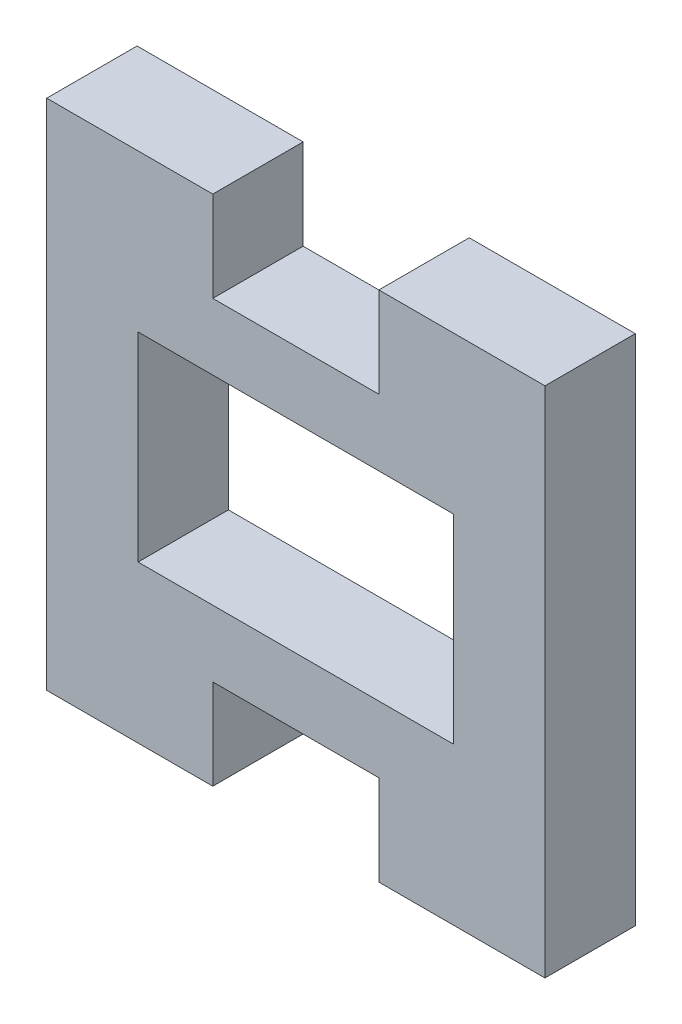
from build123d import *

# Parameters (mm, degrees)
SKETCH1_W           = 30
SKETCH1_H           = 30.88
BOSS_EXTRUDE1_DEPTH = 5.44
SKETCH2_W           = 19
SKETCH2_H           = 12
CUT_EXTRUDE1_DEPTH  = 44.395483636
CAVITY1_OUTLINE_W   = 10
CAVITY1_OUTLINE_H   = 5.44
CAVITY1_DEPTH       = 5.44
CAVITY1_START       = 25.44
CAVITY1_2_OUTLINE_W = 10
CAVITY1_2_OUTLINE_H = 5.44
CAVITY1_2_DEPTH     = 5.44


# Read off the part's stored shape, not the designer's step: Cavity1
with BuildPart() as part:
    # Sketch1 → Boss-Extrude1 (new body)
    with BuildSketch(Plane.XY):
        with Locations((15, 15.44)):
            Rectangle(SKETCH1_W, SKETCH1_H)
    extrude(amount=BOSS_EXTRUDE1_DEPTH)

    # Sketch2 → Cut-Extrude1 (cut, through all)
    with BuildSketch(Plane(origin=(0, 0, 0), x_dir=(-1, 0, 0), z_dir=(0, 0, -1))):
        with Locations((-15, 15.44)):
            Rectangle(SKETCH2_W, SKETCH2_H)
    extrude(amount=-CUT_EXTRUDE1_DEPTH, mode=Mode.SUBTRACT)

    # Cavity1 outline → Cavity1 (cut)
    with BuildSketch(Plane(origin=(0, 0, 0), x_dir=(1, 0, 0), z_dir=(0, 1, 0))):
        with Locations((15, -2.72)):
            Rectangle(CAVITY1_OUTLINE_W, CAVITY1_OUTLINE_H)
    extrude(amount=CAVITY1_DEPTH, mode=Mode.SUBTRACT)

    # Cavity1 2 outline → Cavity1 2 (cut)
    with BuildSketch(Plane(origin=(0, 0, 0), x_dir=(1, 0, 0), z_dir=(0, 1, 0)).offset(CAVITY1_START)):
        with Locations((15, -2.72)):
            Rectangle(CAVITY1_2_OUTLINE_W, CAVITY1_2_OUTLINE_H)
    extrude(amount=CAVITY1_2_DEPTH, mode=Mode.SUBTRACT)


solid = part.part
